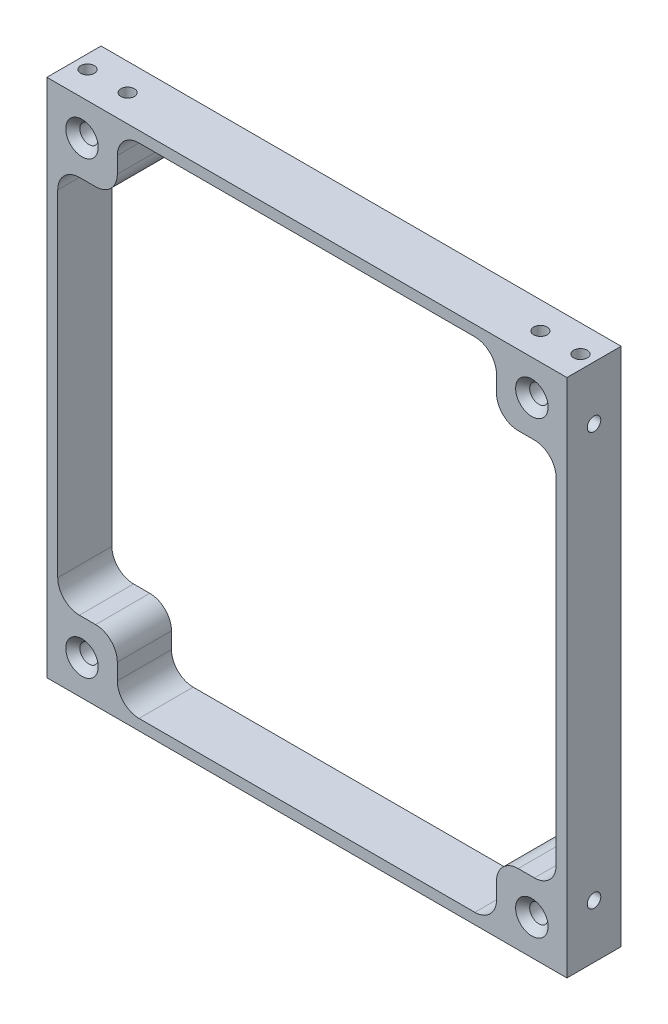
from build123d import *

# Parameters (mm, degrees)
BOTTOMLAYER_DEPTH              = 10
M3_CLEARANCE_HOLE1_D           = 3.4
M3_CLEARANCE_HOLE1_CSINK_D     = 6
M3_CLEARANCE_HOLE1_CSINK_ANGLE = 90
CIRPATTERN1_COUNT              = 4


with BuildPart() as part:
    # Sketch3 → BottomLayer (new body)
    with BuildSketch(Plane.XY):
        with BuildLine():
            Line((0, 48), (48, 48))
            Line((48, 48), (48, 0))
            Line((48, 0), (46, 0))
            Line((46, 0), (46, 31))
            ThreePointArc((46, 31), (44.828427125, 33.828427125), (42, 35))
            Line((42, 35), (39, 35))
            ThreePointArc((39, 35), (36.171572875, 36.171572875), (35, 39))
            Line((35, 39), (35, 42))
            ThreePointArc((35, 42), (33.828427125, 44.828427125), (31, 46))
            Line((31, 46), (0, 46))
            Line((0, 46), (0, 48))
        make_face()
    bottomlayer = extrude(amount=BOTTOMLAYER_DEPTH)

    # M3 Clearance Hole1 (through all)
    with Locations(Plane.XY.offset(10)):
        with Locations((41.525, 41.525)):
            m3_clearance_hole1 = CounterSinkHole(M3_CLEARANCE_HOLE1_D / 2, M3_CLEARANCE_HOLE1_CSINK_D / 2, counter_sink_angle=M3_CLEARANCE_HOLE1_CSINK_ANGLE)

    # CirPattern1: BottomLayer, M3 Clearance Hole1 ×4 about axis
    cirpattern1_axis = Axis((0, 0, -0.5), (0, 0, 1))
    add([bottomlayer.rotate(cirpattern1_axis, i * 360 / CIRPATTERN1_COUNT) for i in range(1, CIRPATTERN1_COUNT)])
    add([m3_clearance_hole1.rotate(cirpattern1_axis, i * 360 / CIRPATTERN1_COUNT) for i in range(1, CIRPATTERN1_COUNT)], mode=Mode.SUBTRACT)

    # Sketch21 → Tap Drill M3 Side Plate (revolve, cut)
    with BuildSketch(Plane(origin=(48, 38.1, 5), x_dir=(0, 0, -1), z_dir=(0, 1, 0))):
        Polygon((0, 0), (0, 5.751075774), (1.25, 5), (1.25, 0), align=None)
    tap_drill_m3_side_plate = revolve(axis=Axis((54.35, 38.1, 5), (-1, 0, 0)), mode=Mode.SUBTRACT)

    # Sketch27 → Tap Drill M3 Side Plate 2 (revolve, cut)
    with BuildSketch(Plane(origin=(38.1, 48, 5), x_dir=(0, 0, 1), z_dir=(1, 0, 0))):
        Polygon((0, 0), (0, 5.751075774), (1.25, 5), (1.25, 0), align=None)
    tap_drill_m3_side_plate_2 = revolve(axis=Axis((38.1, 54.35, 5), (0, -1, 0)), mode=Mode.SUBTRACT)

    # Sketch29 → Tap Drill M3 Rail (revolve, cut)
    with BuildSketch(Plane(origin=(45.5, 48, 5), x_dir=(0, 0, 1), z_dir=(1, 0, 0))):
        Polygon((0, 0), (0, 5.751075774), (1.25, 5), (1.25, 0), align=None)
    tap_drill_m3_rail = revolve(axis=Axis((45.5, 54.35, 5), (0, -1, 0)), mode=Mode.SUBTRACT)

    # SidePlate and Rail Holes 1: Tap Drill M3 Side Plate, Tap Drill M3 Side Plate 2, Tap Drill M3 Rail across plane
    add(tap_drill_m3_side_plate.mirror(Plane(origin=(0, 0, 0), x_dir=(0, 0, 1), z_dir=(1, 0, 0))), mode=Mode.SUBTRACT)
    add(tap_drill_m3_side_plate_2.mirror(Plane(origin=(0, 0, 0), x_dir=(0, 0, 1), z_dir=(1, 0, 0))), mode=Mode.SUBTRACT)
    add(tap_drill_m3_rail.mirror(Plane(origin=(0, 0, 0), x_dir=(0, 0, 1), z_dir=(1, 0, 0))), mode=Mode.SUBTRACT)

    # Side Plate and Rail Holes 2 copy 1 sketc → Side Plate and Rail Holes 2 copy 1 (revolve, cut)
    with BuildSketch(Plane(origin=(-48, -38.1, 5), x_dir=(0, 0, -1), z_dir=(0, -1, 0))):
        Polygon((0, 0), (0, 5.751075774), (1.25, 5), (1.25, 0), align=None)
    revolve(axis=Axis((-54.35, -38.1, 5), (1, 0, 0)), mode=Mode.SUBTRACT)

    # Side Plate and Rail Holes 2 copy 2 sketc → Side Plate and Rail Holes 2 copy 2 (revolve, cut)
    with BuildSketch(Plane(origin=(-38.1, -48, 5), x_dir=(0, 0, 1), z_dir=(-1, 0, 0))):
        Polygon((0, 0), (0, 5.751075774), (1.25, 5), (1.25, 0), align=None)
    revolve(axis=Axis((-38.1, -54.35, 5), (0, 1, 0)), mode=Mode.SUBTRACT)

    # Side Plate and Rail Holes 2 copy 3 sketc → Side Plate and Rail Holes 2 copy 3 (revolve, cut)
    with BuildSketch(Plane(origin=(-45.5, -48, 5), x_dir=(0, 0, 1), z_dir=(-1, 0, 0))):
        Polygon((0, 0), (0, 5.751075774), (1.25, 5), (1.25, 0), align=None)
    revolve(axis=Axis((-45.5, -54.35, 5), (0, 1, 0)), mode=Mode.SUBTRACT)

    # Side Plate and Rail Holes 2 copy 4 sketc → Side Plate and Rail Holes 2 copy 4 (revolve, cut)
    with BuildSketch(Plane(origin=(48, -38.1, 5), x_dir=(0, 0, -1), z_dir=(0, -1, 0))):
        Polygon((0, 0), (0, -5.751075774), (1.25, -5), (1.25, 0), align=None)
    revolve(axis=Axis((54.35, -38.1, 5), (1, 0, 0)), mode=Mode.SUBTRACT)

    # Side Plate and Rail Holes 2 copy 5 sketc → Side Plate and Rail Holes 2 copy 5 (revolve, cut)
    with BuildSketch(Plane(origin=(38.1, -48, 5), x_dir=(0, 0, 1), z_dir=(1, 0, 0))):
        Polygon((0, 0), (0, -5.751075774), (1.25, -5), (1.25, 0), align=None)
    revolve(axis=Axis((38.1, -54.35, 5), (0, -1, 0)), mode=Mode.SUBTRACT)

    # Side Plate and Rail Holes 2 copy 6 sketc → Side Plate and Rail Holes 2 copy 6 (revolve, cut)
    with BuildSketch(Plane(origin=(45.5, -48, 5), x_dir=(0, 0, 1), z_dir=(1, 0, 0))):
        Polygon((0, 0), (0, -5.751075774), (1.25, -5), (1.25, 0), align=None)
    revolve(axis=Axis((45.5, -54.35, 5), (0, -1, 0)), mode=Mode.SUBTRACT)


solid = part.part
